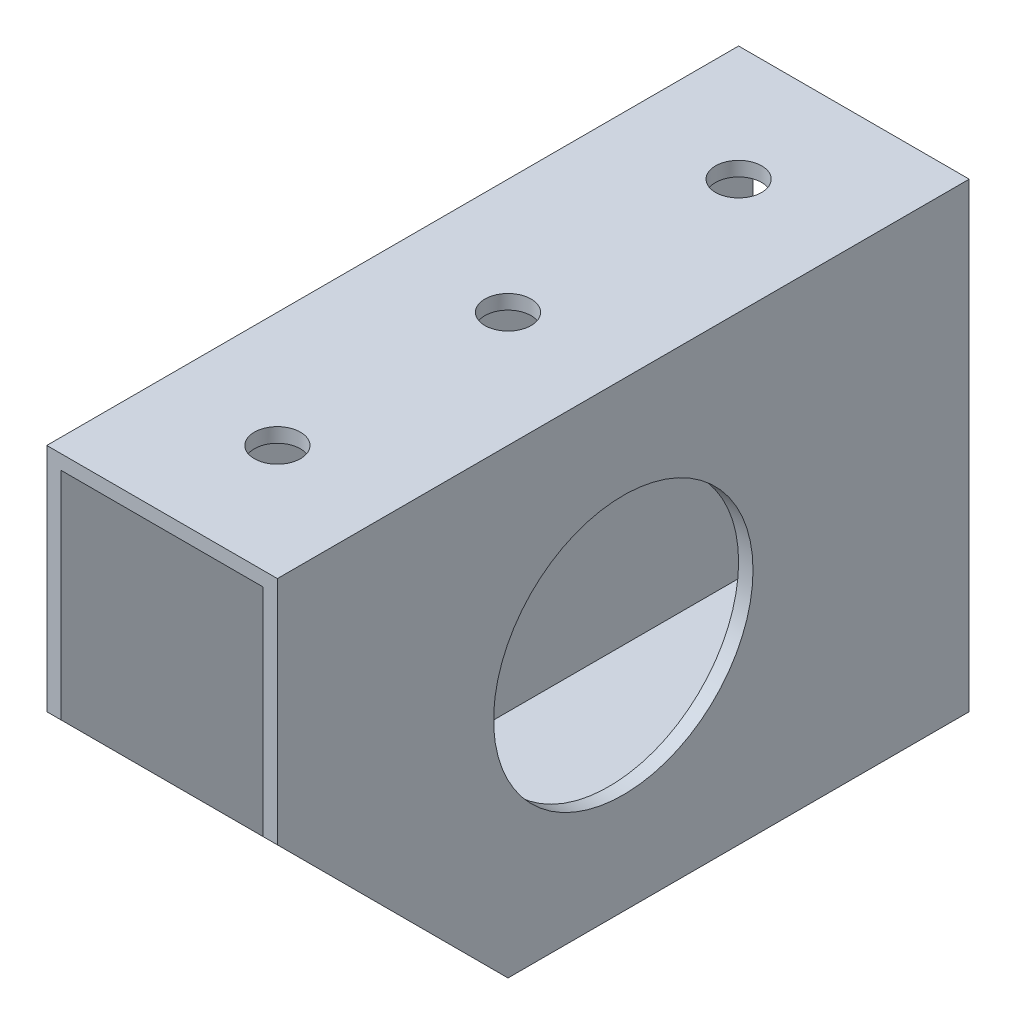
from build123d import *

# Parameters (mm, degrees)
SKETCH1_W           = 25.4
SKETCH1_H           = 50.8
SKETCH1_W_2         = 22.225
SKETCH1_H_2         = 47.625
BOSS_EXTRUDE1_DEPTH = 76.2
SKETCH2_R           = 14.2875
CUT_EXTRUDE1_DEPTH  = 96.038097624
CUT_EXTRUDE2_DEPTH  = 96.038097624
CUT_EXTRUDE3_REACH  = 97.038
SKETCH4_R           = 2.54
CUT_EXTRUDE4_REACH  = 97.038
SKETCH5_R           = 2.54


with BuildPart() as part:
    # Sketch1 → Boss-Extrude1 (new body)
    with BuildSketch(Plane.XY):
        with Locations((12.7, 25.4)):
            Rectangle(SKETCH1_W, SKETCH1_H)
        with Locations((12.7, 25.4)):
            Rectangle(SKETCH1_W_2, SKETCH1_H_2, mode=Mode.SUBTRACT)
    extrude(amount=BOSS_EXTRUDE1_DEPTH)

    # Sketch2 → Cut-Extrude1 (cut, through all)
    with BuildSketch(Plane(origin=(25.4, 0, 0), x_dir=(0, 0, -1), z_dir=(1, 0, 0))):
        with Locations((-38.1, 25.4)):
            Circle(SKETCH2_R)
    extrude(amount=-CUT_EXTRUDE1_DEPTH, mode=Mode.SUBTRACT)

    # Sketch3 → Cut-Extrude2 (cut, through all)
    with BuildSketch(Plane(origin=(25.4, 0, 0), x_dir=(0, 0, -1), z_dir=(1, 0, 0))):
        Polygon((-50.8, 0), (-76.2, 25.4), (-76.2, 0), align=None)
    extrude(amount=-CUT_EXTRUDE2_DEPTH, mode=Mode.SUBTRACT)

    # Sketch4 → Cut-Extrude3 (cut, up to next)
    with BuildSketch(Plane(origin=(0, 50.8, 0), x_dir=(1, 0, 0), z_dir=(0, 1, 0)), mode=Mode.PRIVATE) as cut_extrude3_sk1:
        with Locations((12.7, -12.7)):
            Circle(SKETCH4_R)
    cut_extrude3_tool1 = extrude(cut_extrude3_sk1.sketch, amount=-CUT_EXTRUDE3_REACH, mode=Mode.PRIVATE) & part.part
    # Sketch4 → Cut-Extrude3 (cut, up to next)
    with BuildSketch(Plane(origin=(0, 50.8, 0), x_dir=(1, 0, 0), z_dir=(0, 1, 0)), mode=Mode.PRIVATE) as cut_extrude3_sk2:
        with Locations((12.7, -38.1)):
            Circle(SKETCH4_R)
    cut_extrude3_tool2 = extrude(cut_extrude3_sk2.sketch, amount=-CUT_EXTRUDE3_REACH, mode=Mode.PRIVATE) & part.part
    # Sketch4 → Cut-Extrude3 (cut, up to next)
    with BuildSketch(Plane(origin=(0, 50.8, 0), x_dir=(1, 0, 0), z_dir=(0, 1, 0)), mode=Mode.PRIVATE) as cut_extrude3_sk3:
        with Locations((12.7, -63.5)):
            Circle(SKETCH4_R)
    cut_extrude3_tool3 = extrude(cut_extrude3_sk3.sketch, amount=-CUT_EXTRUDE3_REACH, mode=Mode.PRIVATE) & part.part
    add(cut_extrude3_tool1.solids().sort_by_distance((12.7, 50.8, 12.7))[0], mode=Mode.SUBTRACT)
    add(cut_extrude3_tool2.solids().sort_by_distance((12.7, 50.8, 38.1))[0], mode=Mode.SUBTRACT)
    add(cut_extrude3_tool3.solids().sort_by_distance((12.7, 50.8, 63.5))[0], mode=Mode.SUBTRACT)

    # Sketch5 → Cut-Extrude4 (cut, up to next)
    with BuildSketch(Plane.XZ, mode=Mode.PRIVATE) as cut_extrude4_sk1:
        with Locations((12.7, 12.7)):
            Circle(SKETCH5_R)
    cut_extrude4_tool1 = extrude(cut_extrude4_sk1.sketch, amount=-CUT_EXTRUDE4_REACH, mode=Mode.PRIVATE) & part.part
    # Sketch5 → Cut-Extrude4 (cut, up to next)
    with BuildSketch(Plane.XZ, mode=Mode.PRIVATE) as cut_extrude4_sk2:
        with Locations((12.7, 39.6875)):
            Circle(SKETCH5_R)
    cut_extrude4_tool2 = extrude(cut_extrude4_sk2.sketch, amount=-CUT_EXTRUDE4_REACH, mode=Mode.PRIVATE) & part.part
    add(cut_extrude4_tool1.solids().sort_by_distance((12.7, 0, 12.7))[0], mode=Mode.SUBTRACT)
    add(cut_extrude4_tool2.solids().sort_by_distance((12.7, 0, 39.6875))[0], mode=Mode.SUBTRACT)


solid = part.part
